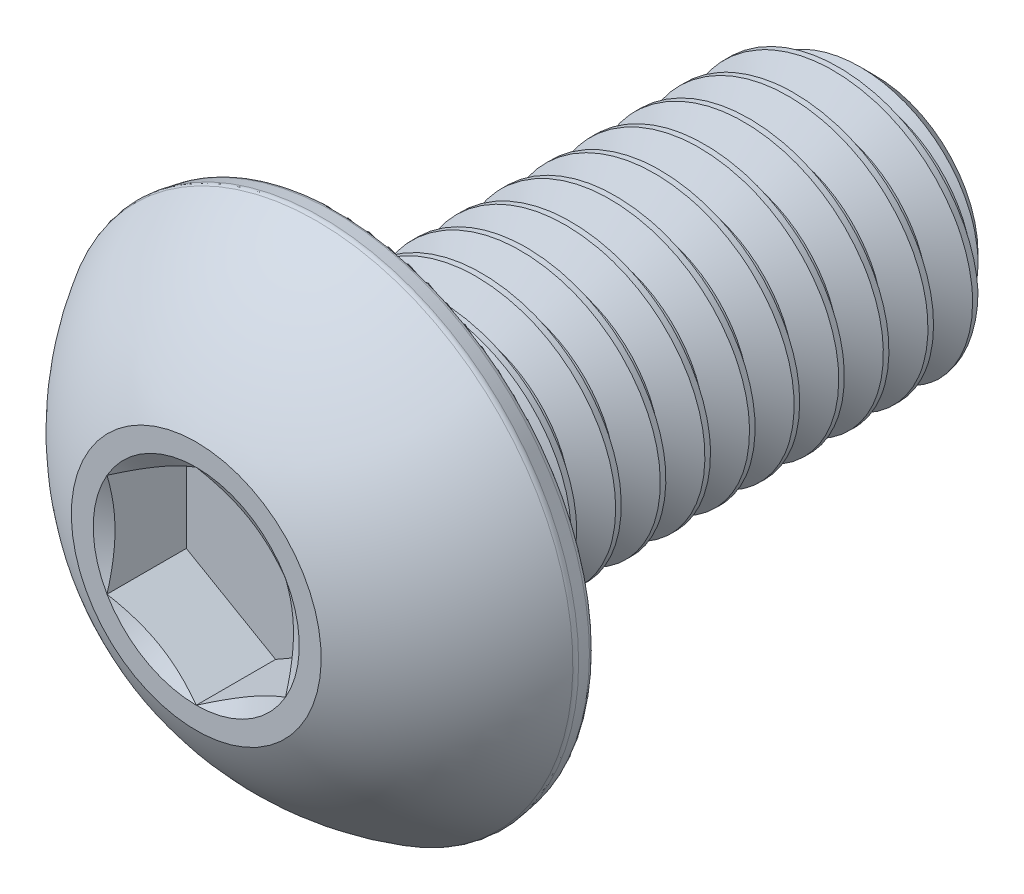
from build123d import *

# Parameters (mm, degrees)
CUT_EXTRUDE1_DEPTH = 1.41097
FILLET1_R          = 0.12827
CUT_SWEEP1_PITCH   = 0.79375
CUT_SWEEP1_TO      = 9.525


with BuildPart() as part:
    # Sketch3 → Revolve1 (revolve)
    with BuildSketch(Plane(origin=(0, 0, 0), x_dir=(0, 0, -1), z_dir=(1, 0, 0)), mode=Mode.PRIVATE) as revolve1_sk:
        with BuildLine():
            Line((-6.0452, 0), (-6.0452, 2.2225))
            ThreePointArc((-6.0452, 2.2225), (-5.13946038, 3.573966445), (-3.86461, 4.5847))
            Line((-3.86461, 4.5847), (-3.4798, 4.516847615))
            Line((-3.4798, 4.516847615), (-3.4798, 2.413))
            Line((-3.4798, 2.413), (5.4498875, 2.413))
            Line((5.4498875, 2.413), (6.0452, 1.8176875))
            Line((6.0452, 1.8176875), (6.0452, 0))
            Line((6.0452, 0), (-6.0452, 0))
        make_face()
    revolve(revolve1_sk.sketch.rotate(Axis((0, 0, 6.0452), (0, 0, -1)), 90), axis=Axis((0, 0, 6.0452), (0, 0, -1)))

    # Sketch4 → Cut-Extrude1 (cut)
    with BuildSketch(Plane.XY.offset(6.0452)):
        Polygon((-1.5875, -0.916543552), (0, -1.833087105), (1.5875, -0.916543552), (1.5875, 0.916543552), (0, 1.833087105), (-1.5875, 0.916543552), align=None)
    extrude(amount=-CUT_EXTRUDE1_DEPTH, mode=Mode.SUBTRACT)

    # Cut-Extrude2 cone 1 section (through the dimple's axis) → Cut-Extrude2 (revolve, cut)
    with BuildSketch(Plane(origin=(0, 0, 6.0452), x_dir=(0, -1, 0), z_dir=(1, 0, 0))):
        Polygon((0, 0), (1.833087105, 0), (0, 1.058333333), align=None)
    revolve(axis=Axis((0, 0, 6.0452), (0, 0, -1)), mode=Mode.SUBTRACT)

    # Fillet1
    fillet1_edges = [part.edges().sort_by_distance(p)[0] for p in [
        (-4.516847615, 0, 3.4798),
        (-4.5847, 0, 3.86461),
    ]]
    fillet(fillet1_edges, radius=FILLET1_R)


with BuildPart() as body_2:
    # Split1: read off the stored shape, not the designer's step
    # Split1: the piece on the far side of the plane
    add(part.part)
    split(bisect_by=Plane.XY.offset(3.4798), keep=Keep.BOTTOM)

    # Cut-Sweep1: arcs per turn and ends read off the stored shape
    # Cut-Sweep1: the profile of Sketch7 screwed along a right-hand helix through 13 turns, 8 arcs to a turn; built about Z, then put on its axis
    cut_sweep1_z = Axis((0, 0, 0), (0, 0, 1))
    cut_sweep1_corners = [(2.455962979, 0, 0.024804687), (2.455962979, 0, -0.719335938), (1.897444252, 0, -0.396875), (1.897444252, 0, -0.29765625)]
    with BuildLine(mode=Mode.PRIVATE) as cut_sweep1_profile:
        Line(cut_sweep1_corners[0], cut_sweep1_corners[1])
        Line(cut_sweep1_corners[1], cut_sweep1_corners[2])
        Line(cut_sweep1_corners[2], cut_sweep1_corners[3])
        Line(cut_sweep1_corners[3], cut_sweep1_corners[0])
    cut_sweep1_cap = Face(cut_sweep1_profile.wire())
    cut_sweep1_turn_angles = [0, 22.5, 45, 67.5, 90, 112.5, 135, 157.5, 180, 202.5, 225, 247.5, 270, 292.5, 315, 337.5, 360]
    cut_sweep1_turn_weights = [1, 0.9238795325112867, 1, 0.9238795325112867, 1, 0.9238795325112867, 1, 0.9238795325112867, 1, 0.9238795325112867, 1, 0.9238795325112867, 1, 0.9238795325112867, 1, 0.9238795325112867, 1]
    cut_sweep1_turn_rails = [Edge.make_bspline([Vector(p[0], p[1], 0).rotate(cut_sweep1_z, cut_sweep1_turn_angles[k]) / cut_sweep1_turn_weights[k] + Vector(0, 0, p[2] + CUT_SWEEP1_PITCH * cut_sweep1_turn_angles[k] / 360) for k in range(17)], [0, 0, 0, 1, 1, 2, 2, 3, 3, 4, 4, 5, 5, 6, 6, 7, 7, 8, 8, 8], 2, cut_sweep1_turn_weights) for p in cut_sweep1_corners]
    cut_sweep1_turn_sides = [Face.make_surface_from_curves(cut_sweep1_turn_rails[p[0]], cut_sweep1_turn_rails[p[1]]) for p in [(0, 1), (1, 2), (2, 3), (3, 0)]]
    cut_sweep1 = Plane(origin=(0, 0, -6.0452), x_dir=(0, 1, 0), z_dir=(0, 0, 1)) * split(Solid(Shell([*[p.moved(Location((0, 0, CUT_SWEEP1_PITCH * i))) for i in range(13) for p in cut_sweep1_turn_sides], cut_sweep1_cap, cut_sweep1_cap.rotate(cut_sweep1_z, 4680).moved(Location((0, 0, CUT_SWEEP1_PITCH * 4680 / 360)))])), bisect_by=Plane.XY.offset(CUT_SWEEP1_TO), keep=Keep.BOTTOM, mode=Mode.PRIVATE)
    add(cut_sweep1, mode=Mode.SUBTRACT)


with BuildPart() as part_1:
    add(part.part)

    # Split1
    split(bisect_by=Plane.XY.offset(3.4798), keep=Keep.TOP)

    add(body_2.part)  # Boss-Extrude1 merges body 2
    # Boss-Extrude1: read off the stored shape, not the designer's step
    # Boss-Extrude1 outline → Boss-Extrude1 (revolve)
    with BuildSketch(Plane.XZ):
        Polygon((1.897438552, 3.4798), (1.897438552, 2.878312594), (2.498925958, 3.4798), align=None)
    revolve(axis=Axis((0, 0, 0), (0, 0, 1)))


solid = part_1.part
